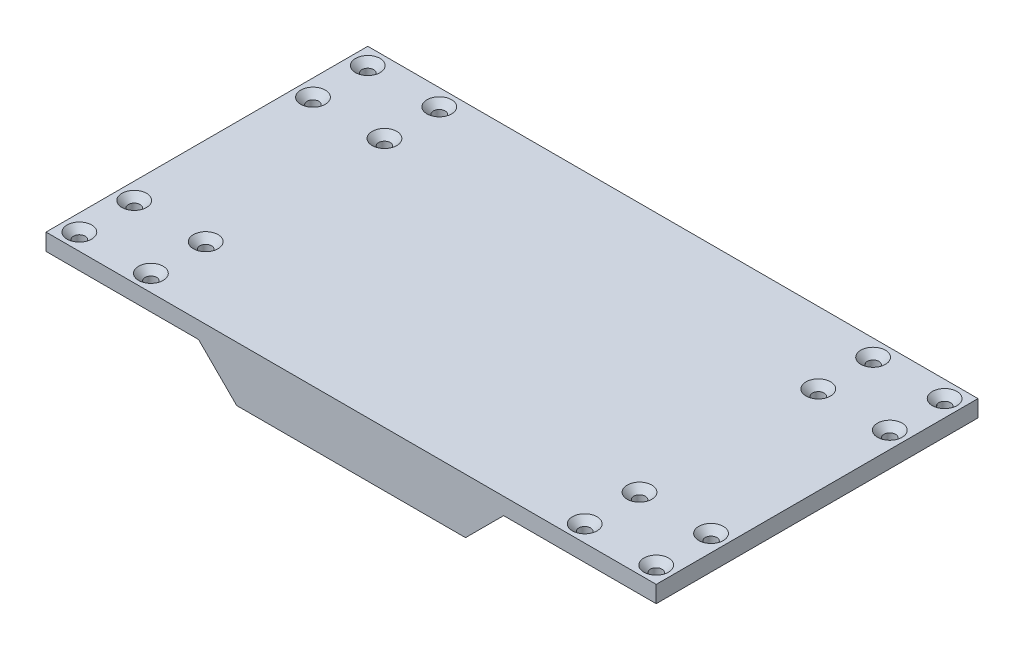
from build123d import *

# Parameters (mm, degrees)
SKETCH1_W                                         = 203.2
SKETCH1_H                                         = 107.15625
BOSS_EXTRUDE1_DEPTH                               = 5.588
CSK_FOR_M3_5_FLAT_HEAD_MACHINE_SCREW1_D           = 3.9
CSK_FOR_M3_5_FLAT_HEAD_MACHINE_SCREW1_CSINK_D     = 8.2
CSK_FOR_M3_5_FLAT_HEAD_MACHINE_SCREW1_CSINK_ANGLE = 90


with BuildPart() as part:
    # Sketch1 → Boss-Extrude1 (new body)
    with BuildSketch(Plane(origin=(0, 0, 0), x_dir=(1, 0, 0), z_dir=(0, 1, 0))):
        with Locations((101.6, 53.578125)):
            Rectangle(SKETCH1_W, SKETCH1_H)
    extrude(amount=BOSS_EXTRUDE1_DEPTH)

    # CSK for M3.5 Flat Head Machine Screw1 (through all)
    with Locations(Plane(origin=(0, 5.588, 0), x_dir=(1, 0, 0), z_dir=(0, 1, 0))):
        with Locations((5.55625, 101.6), (1.201469153, 116.400099152), (1.201469153, 113.370035287), (29.36875, 101.6), (5.55625, 5.55625), (29.36875, 5.55625), (173.83125, 5.55625), (173.83125, 101.6), (197.64375, 101.6), (197.64375, 5.55625), (5.55625, 83.34375), (29.36875, 83.34375), (5.55625, 23.8125), (173.83125, 83.34375), (197.64375, 83.34375), (173.83125, 23.8125), (197.64375, 23.8125), (29.36875, 23.8125)):
            CounterSinkHole(CSK_FOR_M3_5_FLAT_HEAD_MACHINE_SCREW1_D / 2, CSK_FOR_M3_5_FLAT_HEAD_MACHINE_SCREW1_CSINK_D / 2, counter_sink_angle=CSK_FOR_M3_5_FLAT_HEAD_MACHINE_SCREW1_CSINK_ANGLE)

    # Sketch4 → Loft4 section 0
    with BuildSketch(Plane.XZ):
        with BuildLine():
            Line((50.8, 0), (152.4, 0))
            Line((152.4, 0), (152.4, -107.15625))
            Line((152.4, -107.15625), (50.8, -107.15625))
            Line((50.8, -107.15625), (50.8, 0))
        make_face()
    # Sketch5 → Loft4 section 1
    with BuildSketch(Plane(origin=(0, -12.7, 0), x_dir=(-1, 0, 0), z_dir=(0, -1, 0))):
        with BuildLine():
            Line((-139.7, 107.15625), (-63.5, 107.15625))
            Line((-63.5, 107.15625), (-63.5, 0))
            Line((-63.5, 0), (-139.7, 0))
            Line((-139.7, 0), (-139.7, 107.15625))
        make_face()
    loft()


solid = part.part
